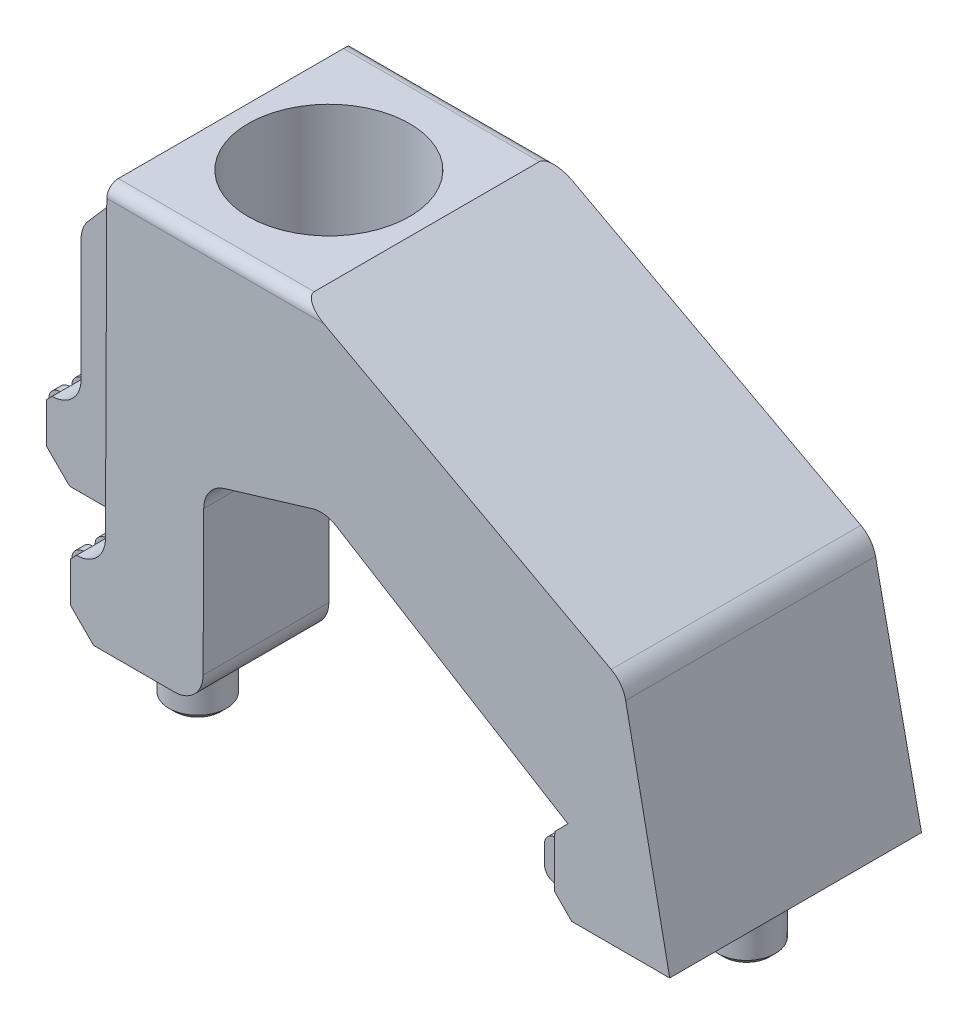
from build123d import *

# Parameters (mm, degrees)
BOSS_EXTRUDE2_DEPTH    = 30
CUT_EXTRUDE1_DEPTH     = 15
SKETCH3_W              = 8.5
SKETCH3_H              = 18.15
BOSS_EXTRUDE3_DEPTH    = 15
SKETCH5_W              = 8.5
SKETCH5_H              = 15
BOSS_EXTRUDE4_DEPTH    = 16.85
SKETCH6_W              = 15
SKETCH6_H              = 6
BOSS_EXTRUDE5_DEPTH    = 3
SKETCH7_W              = 15
SKETCH7_H              = 6
BOSS_EXTRUDE6_DEPTH    = 3
SKETCH8_W              = 30
SKETCH8_H              = 6
BOSS_EXTRUDE7_DEPTH    = 3
CHAMFER1_SIZE          = 2
CHAMFER2_SIZE          = 1.5
CHAMFER3_SIZE          = 3
CHAMFER3_SIZE_2        = 2.183174922
CHAMFER4_SIZE          = 0.5
SKETCH9_W              = 0.797335682
SKETCH9_H              = 3.5
BOSS_EXTRUDE8_DEPTH    = 1
FILLET1_R              = 1
LPATTERN2_COUNT        = 7
LPATTERN2_PITCH        = 2
FILLET1_OF_LPATTERN2_R = 1
SKETCH11_W             = 0.797335682
SKETCH11_H             = 3.5
BOSS_EXTRUDE9_DEPTH    = 1
FILLET2_R              = 1
LPATTERN3_COUNT        = 7
LPATTERN3_PITCH        = 2
FILLET2_OF_LPATTERN3_R = 1
SKETCH12_W             = 0.797335682
SKETCH12_H             = 3.5
BOSS_EXTRUDE10_DEPTH   = 1
FILLET3_R              = 1
LPATTERN4_COUNT        = 14
LPATTERN4_PITCH        = 2
FILLET3_OF_LPATTERN4_R = 1
FILLET4_R              = 2.5
SKETCH13_R             = 7
CUT_EXTRUDE4_DEPTH     = 15
SKETCH14_R             = 2.5
BOSS_EXTRUDE11_DEPTH   = 5
FILLET5_R              = 0.5
CHAMFER5_SIZE          = 0.5
SKETCH15_R             = 2.5
BOSS_EXTRUDE12_DEPTH   = 5
FILLET6_R              = 0.5
CHAMFER6_SIZE          = 0.5
SKETCH16_R             = 2.5
BOSS_EXTRUDE13_DEPTH   = 5
FILLET7_R              = 0.5
CHAMFER7_SIZE          = 0.5
CHAMFER8_SIZE          = 4
FILLET8_R              = 2
CUT_EXTRUDE5_DEPTH     = 78.259303647
FILLET9_R              = 1
BOSS_EXTRUDE15_DEPTH   = 0.5


# Some blends are built 0.0001 mm under size
with BuildPart() as part:
    # Sketch1 → Boss-Extrude2 (new body)
    with BuildSketch(Plane.XY):
        Polygon((0, 0), (0, 20), (13, 35), (30, 35), (57.858157213, 20), (62, 0), (55, 0), (55, 6), (32, 20), (7, 12.5), (7, 0), align=None)
    extrude(amount=BOSS_EXTRUDE2_DEPTH)

    # Sketch2 → Cut-Extrude1 (cut)
    with BuildSketch(Plane.XY.offset(30)):
        Polygon((21.5, 35), (21.5, 16.85), (7, 12.5), (7, 0), (0, 0), (0, 20), (13, 35), align=None)
    extrude(amount=-CUT_EXTRUDE1_DEPTH, mode=Mode.SUBTRACT)

    # Sketch3 → Boss-Extrude3 (add)
    with BuildSketch(Plane.XY.offset(15)):
        with Locations((17.25, 25.925)):
            Rectangle(SKETCH3_W, SKETCH3_H)
    extrude(amount=BOSS_EXTRUDE3_DEPTH)

    # Sketch5 → Boss-Extrude4 (add)
    with BuildSketch(Plane.XZ.offset(-16.85)):
        with Locations((17.25, 22.5)):
            Rectangle(SKETCH5_W, SKETCH5_H)
    extrude(amount=BOSS_EXTRUDE4_DEPTH)

    # Sketch6 → Boss-Extrude5 (add)
    with BuildSketch(Plane.ZY.offset(-13)):
        with Locations((22.5, 3)):
            Rectangle(SKETCH6_W, SKETCH6_H)
    extrude(amount=BOSS_EXTRUDE5_DEPTH)

    # Sketch7 → Boss-Extrude6 (add)
    with BuildSketch(Plane.ZY):
        with Locations((7.5, 3)):
            Rectangle(SKETCH7_W, SKETCH7_H)
    extrude(amount=BOSS_EXTRUDE6_DEPTH)

    # Sketch8 → Boss-Extrude7 (add)
    with BuildSketch(Plane.ZY.offset(-55)):
        with Locations((15, 3)):
            Rectangle(SKETCH8_W, SKETCH8_H)
    extrude(amount=BOSS_EXTRUDE7_DEPTH)

    # Chamfer1
    chamfer1_edges = [part.edges().sort_by_distance(p)[0] for p in [
        (10, 0, 22.5),
        (-3, 0, 7.5),
    ]]
    chamfer(chamfer1_edges, length=CHAMFER1_SIZE)

    # Chamfer2
    chamfer2_edges = [part.edges().sort_by_distance(p)[0] for p in [
        (52, 0, 15),
    ]]
    chamfer(chamfer2_edges, length=CHAMFER2_SIZE)

    # Chamfer3
    # the kernel refuses this chamfer: 3, 2.183174922 mm, written as the material it adds along each edge
    with BuildSketch(Plane(origin=(55, 6, 0), x_dir=(-0.9996219169112968, -0.02749587661058648, 0), z_dir=(0, 0, 1))) as chamfer3_piece_1_section:
        Polygon((CHAMFER3_SIZE * 0.999621916911, -CHAMFER3_SIZE * 0.0274958766106), (CHAMFER3_SIZE_2 * 0.839579200418, -CHAMFER3_SIZE_2 * 0.543237301787), (0, 0), align=None)
    chamfer3_piece_1 = extrude(amount=30, mode=Mode.PRIVATE)
    chamfer3_piece_1 = split(chamfer3_piece_1, bisect_by=Plane(origin=(52, 6.364890908, 15), z_dir=(1, 0, 0)), keep=Keep.TOP, mode=Mode.PRIVATE)
    add(chamfer3_piece_1)

    # Chamfer4
    chamfer4_edges = [part.edges().sort_by_distance(p)[0] for p in [
        (-3, 6, 7.5),
        (10, 6, 22.5),
    ]]
    chamfer(chamfer4_edges, length=CHAMFER4_SIZE)

    # Sketch9 → Boss-Extrude8 (add)
    with BuildSketch(Plane.ZY.offset(3)):
        with Locations((1.398667841, 3.75)):
            Rectangle(SKETCH9_W, SKETCH9_H)
    boss_extrude8 = extrude(amount=BOSS_EXTRUDE8_DEPTH)

    # Fillet1
    fillet1_edges = [part.edges().sort_by_distance(p)[0] for p in [
        (-4, 5.5, 1.398667841),
        (-4, 2, 1.398667841),
    ]]
    fillet(fillet1_edges, radius=FILLET1_R - 0.0001)  # a hair under: the kernel refuses the full size

    # LPattern2: Boss-Extrude8 ×7
    with Locations(*[(0, 0, i * LPATTERN2_PITCH) for i in range(1, LPATTERN2_COUNT)]):
        add(boss_extrude8)

    # Fillet1 of LPattern2
    fillet1_of_lpattern2_edges = [part.edges().sort_by_distance(p)[0] for p in [
        (-4, 5.5, 3.398667841),
        (-4, 2, 3.398667841),
        (-4, 5.5, 5.398667841),
        (-4, 2, 5.398667841),
        (-4, 5.5, 7.398667841),
        (-4, 2, 7.398667841),
        (-4, 5.5, 9.398667841),
        (-4, 2, 9.398667841),
        (-4, 5.5, 11.398667841),
        (-4, 2, 11.398667841),
        (-4, 5.5, 13.398667841),
        (-4, 2, 13.398667841),
    ]]
    fillet(fillet1_of_lpattern2_edges, radius=FILLET1_OF_LPATTERN2_R - 0.0001)  # a hair under: the kernel refuses the full size

    # Sketch11 → Boss-Extrude9 (add)
    with BuildSketch(Plane.ZY.offset(-10)):
        with Locations((16.398667841, 3.75)):
            Rectangle(SKETCH11_W, SKETCH11_H)
    boss_extrude9 = extrude(amount=BOSS_EXTRUDE9_DEPTH)

    # Fillet2
    fillet2_edges = [part.edges().sort_by_distance(p)[0] for p in [
        (9, 2, 16.398667841),
        (9, 5.5, 16.398667841),
    ]]
    fillet(fillet2_edges, radius=FILLET2_R - 0.0001)  # a hair under: the kernel refuses the full size

    # LPattern3: Boss-Extrude9 ×7
    with Locations(*[(0, 0, i * LPATTERN3_PITCH) for i in range(1, LPATTERN3_COUNT)]):
        add(boss_extrude9)

    # Fillet2 of LPattern3
    fillet2_of_lpattern3_edges = [part.edges().sort_by_distance(p)[0] for p in [
        (9, 2, 18.398667841),
        (9, 5.5, 18.398667841),
        (9, 2, 20.398667841),
        (9, 5.5, 20.398667841),
        (9, 2, 22.398667841),
        (9, 5.5, 22.398667841),
        (9, 2, 24.398667841),
        (9, 5.5, 24.398667841),
        (9, 2, 26.398667841),
        (9, 5.5, 26.398667841),
        (9, 2, 28.398667841),
        (9, 5.5, 28.398667841),
    ]]
    fillet(fillet2_of_lpattern3_edges, radius=FILLET2_OF_LPATTERN3_R - 0.0001)  # a hair under: the kernel refuses the full size

    # Sketch12 → Boss-Extrude10 (add)
    with BuildSketch(Plane.ZY.offset(-52)):
        with Locations((1.398667841, 3.75)):
            Rectangle(SKETCH12_W, SKETCH12_H)
    boss_extrude10 = extrude(amount=BOSS_EXTRUDE10_DEPTH)

    # Fillet3
    fillet3_edges = [part.edges().sort_by_distance(p)[0] for p in [
        (51, 2, 1.398667841),
        (51, 5.5, 1.398667841),
    ]]
    fillet(fillet3_edges, radius=FILLET3_R - 0.0001)  # a hair under: the kernel refuses the full size

    # LPattern4: Boss-Extrude10 ×14, 2 skipped
    with Locations(*[(0, 0, i * LPATTERN4_PITCH) for i in range(1, LPATTERN4_COUNT) if i not in (6, 7)]):
        add(boss_extrude10)

    # Fillet3 of LPattern4
    fillet3_of_lpattern4_edges = [part.edges().sort_by_distance(p)[0] for p in [
        (51, 2, 3.398667841),
        (51, 5.5, 3.398667841),
        (51, 2, 5.398667841),
        (51, 5.5, 5.398667841),
        (51, 2, 7.398667841),
        (51, 5.5, 7.398667841),
        (51, 2, 9.398667841),
        (51, 5.5, 9.398667841),
        (51, 2, 11.398667841),
        (51, 5.5, 11.398667841),
        (51, 2, 17.398667841),
        (51, 5.5, 17.398667841),
        (51, 2, 19.398667841),
        (51, 5.5, 19.398667841),
        (51, 2, 21.398667841),
        (51, 5.5, 21.398667841),
        (51, 2, 23.398667841),
        (51, 5.5, 23.398667841),
        (51, 2, 25.398667841),
        (51, 5.5, 25.398667841),
        (51, 2, 27.398667841),
        (51, 5.5, 27.398667841),
    ]]
    fillet(fillet3_of_lpattern4_edges, radius=FILLET3_OF_LPATTERN4_R - 0.0001)  # a hair under: the kernel refuses the full size

    # Fillet4
    # the kernel refuses this fillet: 2.5 mm, written as the material it adds along each edge
    with BuildSketch(Plane(origin=(7, 12.5, 0), x_dir=(0, -1, 0), z_dir=(0, 0, 1)), Plane(origin=(21.5, 16.85, 30), x_dir=(0.9578262852211517, 0.2873478855663444, 0), z_dir=(0, 0, -1))) as fillet4_piece_1:
        with BuildLine():
            CenterArc((FILLET4_R * 0.744030650891, FILLET4_R), FILLET4_R, 196.699244234, 73.300755766)
            Line((-FILLET4_R * 0.21379563433, FILLET4_R * 0.712652114434), (0, 0))
            Line((0, 0), (FILLET4_R * 0.744030650891, 0))
        make_face()
    extrude(amount=15)
    with BuildSketch(Plane(origin=(32, 20, 0), x_dir=(-0.9578262852211514, -0.28734788556634544, 0), z_dir=(0, 0, 1))) as fillet4_piece_2:
        with BuildLine():
            CenterArc((FILLET4_R * 0.445520841806, FILLET4_R), FILLET4_R, 221.972062898, 48.027937102)
            Line((-FILLET4_R * 0.297950159661, FILLET4_R * 0.331231826432), (0, 0))
            Line((0, 0), (FILLET4_R * 0.445520841806, 0))
        make_face()
    extrude(amount=30)
    with BuildSketch(Plane(origin=(13, 6, 15), x_dir=(-1, 0, 0), z_dir=(0, 0, 1)), Plane(origin=(0, 6, 0), x_dir=(-1, 0, 0), z_dir=(0, 0, 1))) as fillet4_piece_3:
        with BuildLine():
            CenterArc((FILLET4_R, -FILLET4_R), FILLET4_R, 90, 90)
            Line((0, -FILLET4_R), (0, 0))
            Line((0, 0), (FILLET4_R, 0))
        make_face()
    extrude(amount=15)
    # the kernel refuses this fillet: 2.5 mm, written as the material it takes off along each edge
    with BuildSketch(Plane(origin=(7, 0, -6.25), x_dir=(0, 1, 0), z_dir=(0, 0, 1)), Plane(origin=(21.5, 0, 36.25), x_dir=(-1, 0, 0), z_dir=(0, 0, -1))) as fillet4_2_piece_1:
        with BuildLine():
            CenterArc((FILLET4_R, FILLET4_R), FILLET4_R, 180, 90)
            Line((0, FILLET4_R), (0, 0))
            Line((0, 0), (FILLET4_R, 0))
        make_face()
    extrude(amount=27.5, mode=Mode.SUBTRACT)
    with BuildSketch(Plane(origin=(57.858157213, 20, -2.914422863), x_dir=(0.2027892624076643, -0.979222403262995, 0), z_dir=(0, 0, 1))) as fillet4_2_piece_2:
        with BuildLine():
            CenterArc((FILLET4_R * 0.466307658155, -FILLET4_R), FILLET4_R, 90, 50)
            Line((-FILLET4_R * 0.299736784964, -FILLET4_R * 0.357212390313), (0, 0))
            Line((0, 0), (FILLET4_R * 0.466307658155, 0))
        make_face()
    extrude(amount=35.828845727, mode=Mode.SUBTRACT)
    with BuildSketch(Plane(origin=(0, 20, -2.331458289), x_dir=(0, -1, 0), z_dir=(0, 0, 1))) as fillet4_2_piece_3:
        with BuildLine():
            CenterArc((FILLET4_R * 0.373033326252, FILLET4_R), FILLET4_R, 229.08561678, 40.91438322)
            Line((-FILLET4_R * 0.281897212166, FILLET4_R * 0.24431091721), (0, 0))
            Line((0, 0), (FILLET4_R * 0.373033326252, 0))
        make_face()
    extrude(amount=19.662916578, mode=Mode.SUBTRACT)

    # Sketch13 → Cut-Extrude4 (cut)
    with BuildSketch(Plane(origin=(0, 35, 0), x_dir=(1, 0, 0), z_dir=(0, 1, 0))):
        with Locations(Location((21.5, -15, 0), (0, 0, 270))):
            Circle(SKETCH13_R)
    extrude(amount=-CUT_EXTRUDE4_DEPTH, mode=Mode.SUBTRACT)

    # Sketch14 → Boss-Extrude11 (add)
    with BuildSketch(Plane.XZ):
        with Locations(Location((15.512594381, 20.39, 0), (0, 0, 90))):
            Circle(SKETCH14_R)
    extrude(amount=BOSS_EXTRUDE11_DEPTH)

    # Fillet5
    fillet5_edges = [part.edges().sort_by_distance(p)[0] for p in [
        (15.512594381, 0, 17.89),
    ]]
    fillet(fillet5_edges, radius=FILLET5_R)

    # Chamfer5
    chamfer5_edges = [part.edges().sort_by_distance(p)[0] for p in [
        (15.512594381, -5, 17.89),
    ]]
    chamfer(chamfer5_edges, length=CHAMFER5_SIZE)

    # Sketch15 → Boss-Extrude12 (add)
    with BuildSketch(Plane.XZ):
        with Locations(Location((57.75, 15, 0), (0, 0, 270))):
            Circle(SKETCH15_R)
    extrude(amount=BOSS_EXTRUDE12_DEPTH)

    # Fillet6
    fillet6_edges = [part.edges().sort_by_distance(p)[0] for p in [
        (57.75, 0, 17.5),
    ]]
    fillet(fillet6_edges, radius=FILLET6_R)

    # Chamfer6
    chamfer6_edges = [part.edges().sort_by_distance(p)[0] for p in [
        (57.75, -5, 17.5),
    ]]
    chamfer(chamfer6_edges, length=CHAMFER6_SIZE)

    # Sketch16 → Boss-Extrude13 (add)
    with BuildSketch(Plane(origin=(0, 0, 0), x_dir=(-1, 0, 0), z_dir=(0, -1, 0))):
        with Locations(Location((-1.75, -9.61, 0), (0, 0, 90))):
            Circle(SKETCH16_R)
    extrude(amount=BOSS_EXTRUDE13_DEPTH)

    # Fillet7
    fillet7_edges = [part.edges().sort_by_distance(p)[0] for p in [
        (1.75, 0, 12.11),
    ]]
    fillet(fillet7_edges, radius=FILLET7_R)

    # Chamfer7
    chamfer7_edges = [part.edges().sort_by_distance(p)[0] for p in [
        (1.75, -5, 12.11),
    ]]
    chamfer(chamfer7_edges, length=CHAMFER7_SIZE)

    # Chamfer8
    chamfer8_edges = [part.edges().sort_by_distance(p)[0] for p in [
        (21.5, 35, 0),
        (21.5, 35, 30),
    ]]
    chamfer(chamfer8_edges, length=CHAMFER8_SIZE)

    # Fillet8
    fillet8_edges = [part.edges().sort_by_distance(p)[0] for p in [
        (23.481087628, 31, 0),
        (25.214420962, 31, 30),
    ]]
    fillet(fillet8_edges, radius=FILLET8_R)

    # Sketch17 → Cut-Extrude5 (cut, symmetric)
    with BuildSketch(Plane(origin=(0, 0, 0), x_dir=(0, 0, -1), z_dir=(1, 0, 0))):
        Polygon((-25.92482492, 0), (-25.76536263, 35), (-30.182678602, 35), (-30.342140892, 0), align=None)
    cut_extrude5 = extrude(amount=CUT_EXTRUDE5_DEPTH, both=True, mode=Mode.SUBTRACT)

    # Mirror2: Cut-Extrude5 across plane
    add(cut_extrude5.mirror(Plane.XY.offset(15)), mode=Mode.SUBTRACT)

    # Fillet9
    fillet9_edges = [part.edges().sort_by_distance(p)[0] for p in [
        (21.5, 35, 25.76536263),
        (21.5, 35, 4.23463737),
    ]]
    fillet(fillet9_edges, radius=FILLET9_R)

    # Sketch18 → Boss-Extrude15 (add)
    # profile 1 of 6: a face of its own
    with BuildSketch(Plane(origin=(0, -0.018566379, 4.07509049), x_dir=(-1, 0, 0), z_dir=(0, 0.004556018153835307, -0.9999896212954323))):
        Polygon((-27.056770195, 31.253096615), (-27.056770195, 32.753096615), (-26.136467408, 32.153086636), (-25.216142546, 32.753096615), (-25.216142546, 31.253096615), (-25.658166192, 31.253096615), (-25.658166192, 32.112372801), (-26.136467408, 31.808090461), (-26.610498078, 32.112372801), (-26.610498078, 31.253096615), align=None)
    # profile 2 of 6: a face of its own
    with BuildSketch(Plane(origin=(0, -0.018566379, 4.07509049), x_dir=(-1, 0, 0), z_dir=(0, 0.004556018153835307, -0.9999896212954323))):
        Polygon((-23.550062375, 31.469240039), (-23.357452317, 31.248777381), (-25.035299928, 31.248777381), (-25.035299928, 32.73759721), (-23.353218664, 32.73759721), (-23.543642039, 32.517134553), (-24.585876461, 32.517134553), (-24.585876461, 32.10342679), (-23.453757346, 32.10342679), (-23.453757346, 31.882948104), (-24.585876461, 31.882948104), (-24.585876461, 31.469240039), align=None)
    # profile 3 of 6: a face of its own
    with BuildSketch(Plane(origin=(0, -0.018566379, 4.07509049), x_dir=(-1, 0, 0), z_dir=(0, 0.004556018153835307, -0.9999896212954323))):
        Polygon((-22.290069693, 32.541660711), (-22.637281278, 32.735136248), (-21.847024829, 32.735136248), (-21.847024829, 31.500118492), (-22.290069693, 31.072873622), align=None)
    # profile 4 of 6: a face of its own
    with BuildSketch(Plane(origin=(0, -0.018566379, 4.07509049), x_dir=(-1, 0, 0), z_dir=(0, 0.004556018153835307, -0.9999896212954323))):
        Polygon((-19.946322849, 31.535384522), (-19.946322849, 32.160404808), (-21.188676014, 32.160404808), (-21.188676014, 32.539429878), (-20.066802643, 32.539429878), (-19.877829596, 32.754954584), (-21.626546144, 32.754954584), (-21.626546144, 31.251238646), (-20.198031985, 31.251238646), align=None)
        Polygon((-20.539288634, 31.466763049), (-21.193019743, 31.466763049), (-21.193019743, 31.944880102), (-20.395951648, 31.944880102), (-20.395951648, 31.634996336), align=None, mode=Mode.SUBTRACT)
    # profile 5 of 6: a face of its own
    with BuildSketch(Plane(origin=(0, -0.018566379, 4.07509049), x_dir=(-1, 0, 0), z_dir=(0, 0.004556018153835307, -0.9999896212954323))):
        Polygon((-19.468630976, 31.251238344), (-18.951890607, 31.251238344), (-18.160814644, 32.754954584), (-19.842895606, 32.754954584), (-19.653636788, 32.539429878), (-18.839185918, 32.539429878), align=None)
    # profile 6 of 6: a face of its own
    with BuildSketch(Plane(origin=(0, -0.018566379, 4.07509049), x_dir=(-1, 0, 0), z_dir=(0, 0.004556018153835307, -0.9999896212954323))):
        Polygon((-16.396983047, 32.51773301), (-16.595776355, 32.754954584), (-17.878166575, 32.754954584), (-18.079064009, 32.51773301), (-18.079064009, 31.488387946), (-17.878166575, 31.251238646), (-16.595776355, 31.251238646), (-16.396983047, 31.488387946), align=None)
        Polygon((-16.830509146, 32.413933507), (-16.830509146, 31.596512427), (-16.938890066, 31.466763049), (-17.534988452, 31.466763049), (-17.645537607, 31.596512427), (-17.645537607, 32.413933507), (-17.534988452, 32.539429878), (-16.938890066, 32.539429878), align=None, mode=Mode.SUBTRACT)
    extrude(amount=BOSS_EXTRUDE15_DEPTH)


solid = part.part
